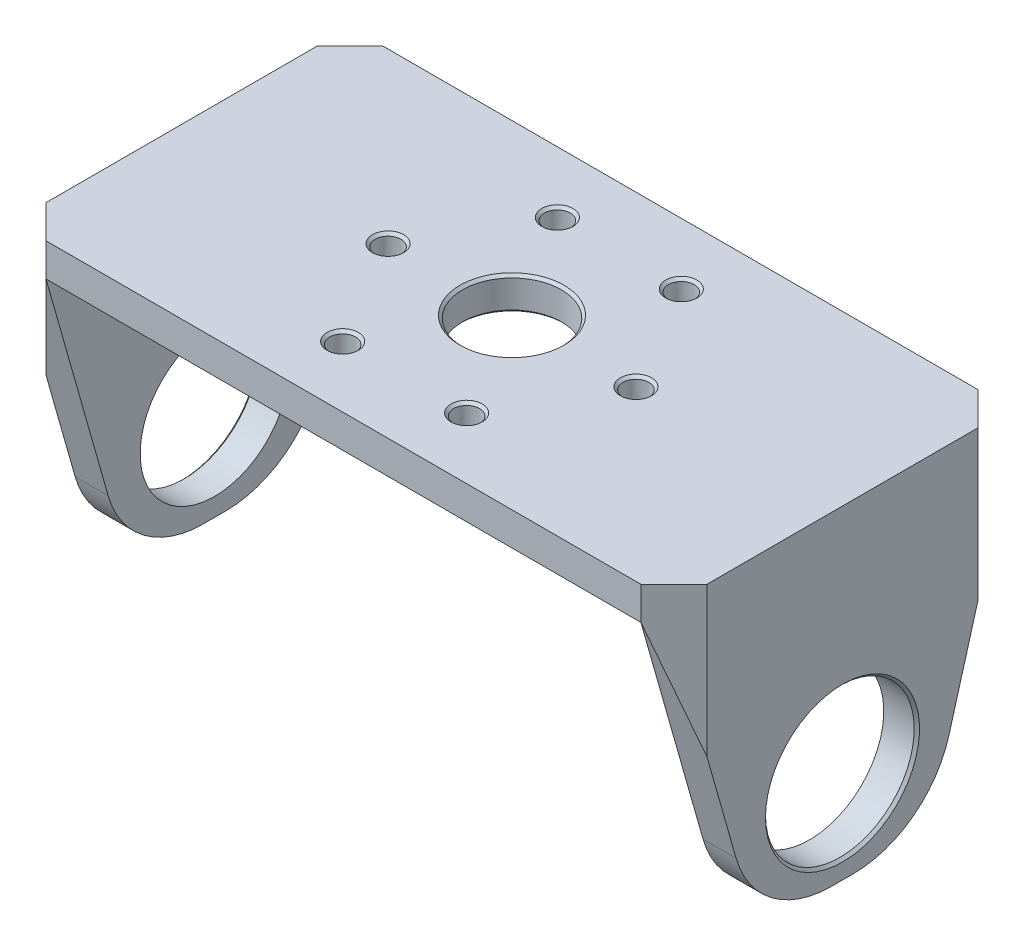
from build123d import *

# Parameters (mm, degrees)
SKETCH1_W                      = 114.3
SKETCH1_H                      = 64.77
BOSS_EXTRUDE1_DEPTH            = 6.35
BOSS_EXTRUDE2_DEPTH            = 6.35
BOSS_EXTRUDE3_DEPTH            = 6.35
HOLE1_D                        = 18.9738
F_9_0_196_DIAMETER_HOLE1_D     = 4.9784
F_9_0_196_DIAMETER_HOLE1_DEPTH = 62.23
F_9_0_196_DIAMETER_HOLE2_D     = 4.9784
HOLE2_D                        = 28.575
HOLE2_DEPTH                    = 6.35
HOLE3_D                        = 28.575
HOLE3_DEPTH                    = 127
CHAMFER1_SIZE                  = 6.35
CHAMFER2_SIZE                  = 0.508
FILLET1_R                      = 19.05


with BuildPart() as part:
    # Sketch1 → Boss-Extrude1 (new body)
    with BuildSketch(Plane(origin=(0, 6.35, 0), x_dir=(1, 0, 0), z_dir=(0, 1, 0))):
        Rectangle(SKETCH1_W, SKETCH1_H)
    extrude(amount=-BOSS_EXTRUDE1_DEPTH)

    # Sketch2 → Boss-Extrude2 (add)
    with BuildSketch(Plane(origin=(57.15, 0, 0), x_dir=(0, 0, -1), z_dir=(1, 0, 0))):
        Polygon((-32.385, 6.35), (32.385, 6.35), (32.385, 0), (16.51, -55.88), (-16.51, -55.88), (-32.385, 0), align=None)
    extrude(amount=BOSS_EXTRUDE2_DEPTH)

    # Sketch3 → Boss-Extrude3 (add)
    with BuildSketch(Plane.ZY.offset(57.15)):
        Polygon((32.385, 0), (16.51, -55.88), (-16.51, -55.88), (-32.385, 0), (-32.385, 6.35), (32.385, 6.35), align=None)
    extrude(amount=BOSS_EXTRUDE3_DEPTH)

    # Hole1 (through all)
    with Locations(Plane(origin=(0, 0, 0), x_dir=(-1, 0, 0), z_dir=(0, -1, 0))):
        with Locations((0, 0)):
            Hole(HOLE1_D / 2)

    # #9 (0.196) Diameter Hole1
    with Locations(Plane(origin=(0, 6.35, 0), x_dir=(1, 0, 0), z_dir=(0, 1, 0))):
        with Locations((11.90625, 20.622229928)):
            Hole(F_9_0_196_DIAMETER_HOLE1_D / 2, depth=F_9_0_196_DIAMETER_HOLE1_DEPTH)

    # #9 (0.196) Diameter Hole2 (through all)
    with Locations(Plane(origin=(0, 0, 0), x_dir=(-1, 0, 0), z_dir=(0, -1, 0))):
        with Locations((-23.8125, 0), (-11.90625, -20.622229928), (11.90625, -20.622229928), (23.8125, 0), (11.90625, 20.622229928)):
            Hole(F_9_0_196_DIAMETER_HOLE2_D / 2)

    # Hole2
    with Locations(Plane.ZY.offset(63.5)):
        with Locations((0, -38.1)):
            Hole(HOLE2_D / 2, depth=HOLE2_DEPTH)

    # Hole3
    with Locations(Plane(origin=(63.5, 0, 0), x_dir=(0, 0, -1), z_dir=(1, 0, 0))):
        with Locations((0, -38.1)):
            Hole(HOLE3_D / 2, depth=HOLE3_DEPTH)

    # Chamfer1
    chamfer1_edges = [part.edges().sort_by_distance(p)[0] for p in [
        (63.5, 3.175, -32.385),
        (63.5, 3.175, 32.385),
        (-63.5, 3.175, -32.385),
        (-63.5, 3.175, 32.385),
    ]]
    chamfer(chamfer1_edges, length=CHAMFER1_SIZE)

    # Chamfer2
    chamfer2_edges = [part.edges().sort_by_distance(p)[0] for p in [
        (-9.4869, 6.35, 0),
        (-14.39545, 6.35, 20.622229928),
        (21.3233, 6.35, 0),
        (14.39545, 0, -20.622229928),
        (-14.39545, 6.35, -20.622229928),
        (-9.4869, 0, 0),
        (-14.39545, 0, -20.622229928),
        (63.5, -38.1, -14.2875),
        (9.41705, 6.35, 20.622229928),
        (-63.5, -38.1, 14.2875),
        (-26.3017, 6.35, 0),
        (14.39545, 6.35, -20.622229928),
        (9.41705, 0, 20.622229928),
        (-26.3017, 0, 0),
        (-14.39545, 0, 20.622229928),
        (21.3233, 0, 0),
    ]]
    chamfer(chamfer2_edges, length=CHAMFER2_SIZE)

    # Fillet1
    fillet1_edges = [part.edges().sort_by_distance(p)[0] for p in [
        (60.325, -55.88, 16.51),
        (-60.325, -55.88, 16.51),
        (60.325, -55.88, -16.51),
        (-60.325, -55.88, -16.51),
    ]]
    fillet(fillet1_edges, radius=FILLET1_R)


solid = part.part
